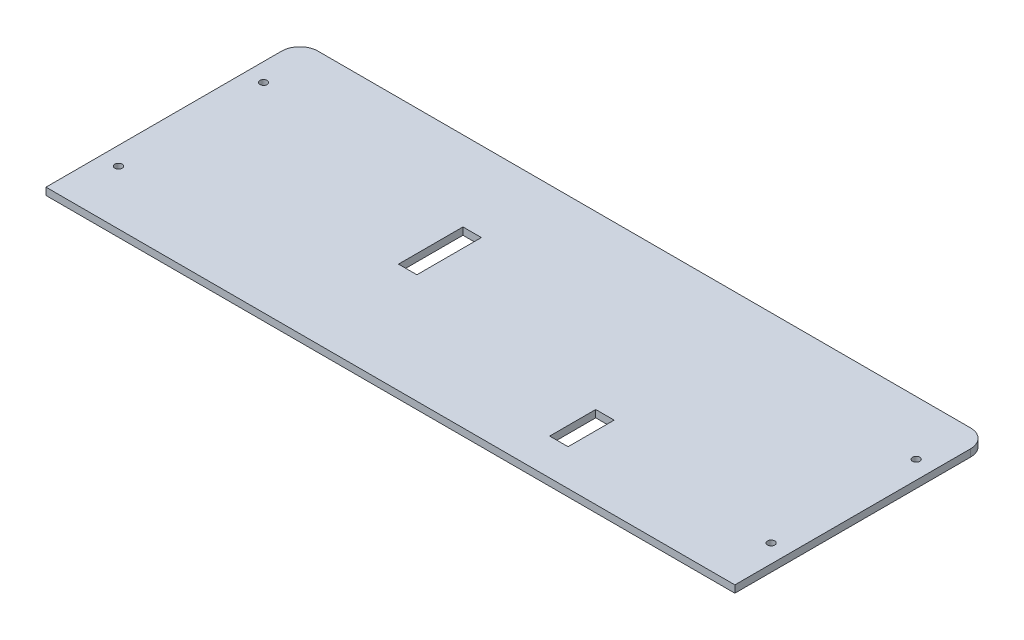
from build123d import *

# Parameters (mm, degrees)
SKETCH_1_R        = 1
SKETCH_1_W        = 5.08
SKETCH_1_H        = 12.7
SKETCH_1_H_2      = 17.78
EXTRUDE_583_DEPTH = 2
SKETCH_2_R        = 5
EXTRUDE_781_DEPTH = 14.5
FILLET_1_SIZE     = 2


with BuildPart() as part:
    # Эскиз1 → Extrude 583 (new body)
    with BuildSketch(Plane(origin=(0, 0, 0), x_dir=(1, 0, 0), z_dir=(0, 1, 0))):
        with BuildLine():
            Line((90, 35), (-90, 35))
            ThreePointArc((-90, 35), (-93.535533906, 33.535533906), (-95, 30))
            Line((-95, 30), (-95, -35))
            Line((-95, -35), (95, -35))
            Line((95, -35), (95, 30))
            ThreePointArc((95, 30), (93.535533906, 33.535533906), (90, 35))
        make_face()
        with Locations(Location((-90, 20, 0), (0, 0, 270))):
            Circle(SKETCH_1_R, mode=Mode.SUBTRACT)
        with Locations(Location((-90, -20, 0), (0, 0, 270))):
            Circle(SKETCH_1_R, mode=Mode.SUBTRACT)
        with Locations(Location((90, -20, 0), (0, 0, 90))):
            Circle(SKETCH_1_R, mode=Mode.SUBTRACT)
        with Locations(Location((90, 20, 0), (0, 0, 90))):
            Circle(SKETCH_1_R, mode=Mode.SUBTRACT)
        with Locations((36.46, -18.65)):
            Rectangle(SKETCH_1_W, SKETCH_1_H, mode=Mode.SUBTRACT)
        with Locations((-25.46, 4.11)):
            Rectangle(SKETCH_1_W, SKETCH_1_H_2, mode=Mode.SUBTRACT)
    extrude(amount=EXTRUDE_583_DEPTH)

    # Эскиз2 → Extrude 781 (add)
    with BuildSketch(Plane(origin=(0, 0, 0), x_dir=(1, 0, 0), z_dir=(0, 1, 0))):
        with Locations(Location((30, 5, 0), (0, 0, 270))):
            Circle(SKETCH_2_R)
        with Locations(Location((-43, 5, 0), (0, 0, 270))):
            Circle(SKETCH_2_R)
    extrude(amount=-EXTRUDE_781_DEPTH)

    # Скругление1
    # a fillet whose section is not a circle: 2 mm, written as the material it adds along each edge
    with BuildSketch(Plane(origin=(30, 0, -5), x_dir=(0, 0, 1), z_dir=(-1, 0, 0))) as fillet_1_piece_1:
        with BuildLine():
            Bezier((5 + FILLET_1_SIZE, 0), (5, 0), (5, -FILLET_1_SIZE), weights=[1, 0.141421356, 1])
            Line((5, -FILLET_1_SIZE), (5, 0))
            Line((5, 0), (5 + FILLET_1_SIZE, 0))
        make_face()
    revolve(axis=Axis((30, 0, -5), (0, 1, 0)))
    with BuildSketch(Plane(origin=(-43, 0, -5), x_dir=(0, 0, 1), z_dir=(-1, 0, 0))) as fillet_1_piece_2:
        with BuildLine():
            Bezier((5 + FILLET_1_SIZE, 0), (5, 0), (5, -FILLET_1_SIZE), weights=[1, 0.141421356, 1])
            Line((5, -FILLET_1_SIZE), (5, 0))
            Line((5, 0), (5 + FILLET_1_SIZE, 0))
        make_face()
    revolve(axis=Axis((-43, 0, -5), (0, 1, 0)))


solid = part.part
